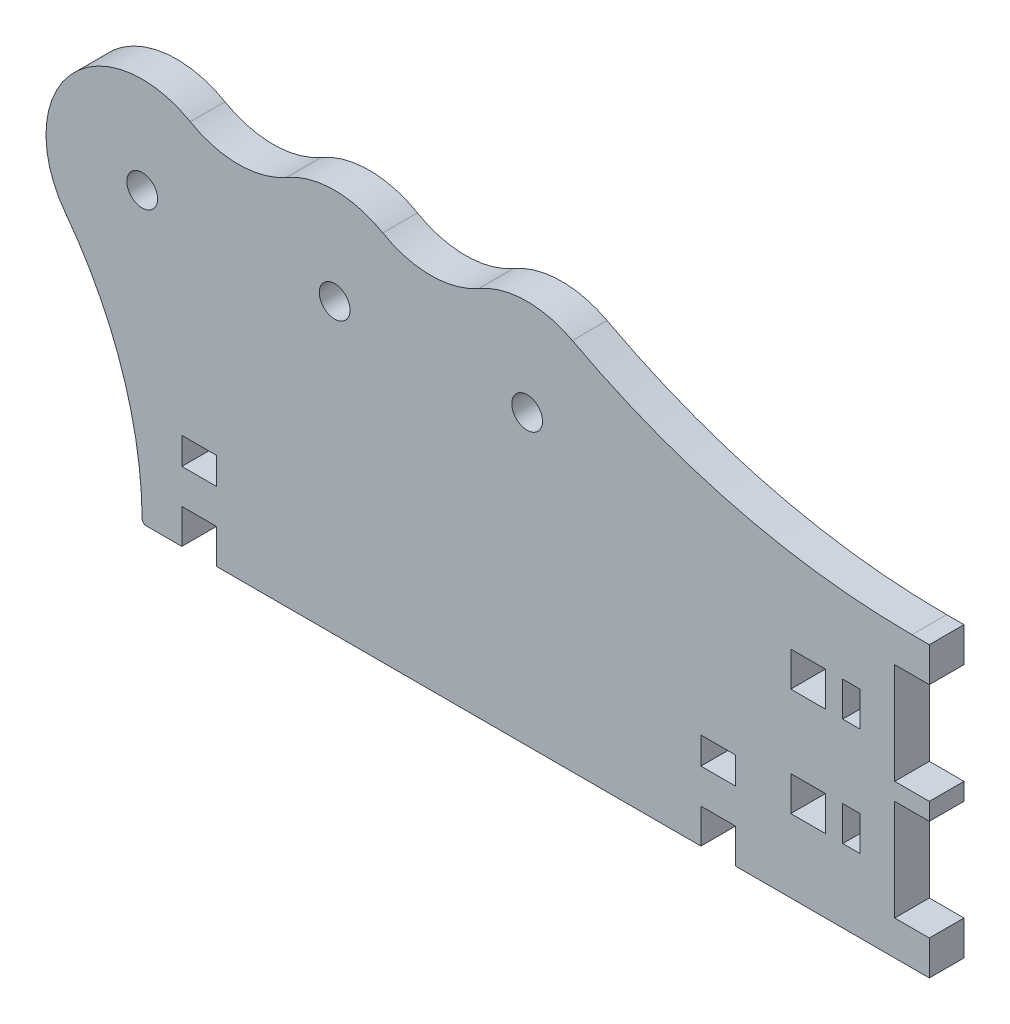
from build123d import *

# Parameters (mm, degrees)
SKETCH1_R                = 8
SKETCH1_R_2              = 4
BOSS_EXTRUDE1_DEPTH      = 9
BOSS_EXTRUDE1_2_DEPTH    = 9
SKETCH2_R                = 4
BOSS_EXTRUDE3_DEPTH      = 9
FILLET1_R                = 1
CUT_EXTRUDE1_DEPTH       = 214.789616212
SKETCH4_W                = 9
SKETCH4_H                = 27
BOSS_EXTRUDE4_DEPTH      = 75
BOSS_EXTRUDE5_START      = 9
SKETCH5_R                = 25
SKETCH5_R_2              = 4
BOSS_EXTRUDE5_DEPTH      = 9
BOSS_EXTRUDE6_DEPTH      = 4.5
BOSS_EXTRUDE6_DEPTH_BACK = 4.5
BOSS_EXTRUDE7_DEPTH      = 4.5
BOSS_EXTRUDE7_DEPTH_BACK = 4.5
BOSS_EXTRUDE7_START      = -25
SKETCH9_W                = 9
SKETCH9_H                = 7
SKETCH9_H_2              = 9
CUT_EXTRUDE2_DEPTH       = 217.612557346
CUT_EXTRUDE3_DEPTH       = 216.299790989
CUT_EXTRUDE3_DEPTH_BACK  = 216.299790989
CAVITY1_START            = -66
CAVITY1_OUTLINE_W        = 9
CAVITY1_OUTLINE_H        = 9
CAVITY1_DEPTH            = 26.25
CAVITY1_START_2          = -35.25
CAVITY1_2_OUTLINE_W      = 9
CAVITY1_2_OUTLINE_H      = 9
CAVITY1_2_DEPTH          = 26.25
CAVITY1_START_3          = -56
CAVITY1_3_OUTLINE_W      = 4.5
CAVITY1_3_OUTLINE_H      = 9
CAVITY1_3_OUTLINE_W_2    = 9
CAVITY1_3_DEPTH          = 9
CAVITY1_START_4          = -28
CAVITY1_4_OUTLINE_W      = 4.5
CAVITY1_4_OUTLINE_H      = 9
CAVITY1_4_OUTLINE_W_2    = 9
CAVITY1_4_DEPTH          = 9


# Read off the part's stored shape, not the designer's step: Cavity1
with BuildPart() as part:
    # Sketch1 → Boss-Extrude1 (new body)
    with BuildSketch(Plane.XY):
        with Locations((-125, 0)):
            Circle(SKETCH1_R)
        with Locations((-125, 0)):
            Circle(SKETCH1_R_2, mode=Mode.SUBTRACT)
    extrude(amount=BOSS_EXTRUDE1_DEPTH)



with BuildPart() as body_2:
    # Sketch1 → Boss-Extrude1 2 (new body)
    with BuildSketch(Plane.XY):
        with Locations((125, 0)):
            Circle(SKETCH1_R)
        with Locations((125, 0)):
            Circle(SKETCH1_R_2, mode=Mode.SUBTRACT)
    extrude(amount=BOSS_EXTRUDE1_2_DEPTH)


with BuildPart() as part_1:
    add(part.part)

    add(body_2.part)  # Boss-Extrude3 merges body 2
    # Sketch2 → Boss-Extrude3 (add)
    with BuildSketch(Plane.XY):
        with BuildLine():
            Line((-175, -75), (125, -75))
            ThreePointArc((125, -75), (130.131670325, -43.377223009), (145.000000492, -14.999999344))
            ThreePointArc((145.000000492, -14.999999344), (143.981414944, 16.269784471), (113.235294528, 22.058823748))
            ThreePointArc((113.235294528, 22.058823748), (25.000000075, 0), (-63.235294395, 22.058823677))
            ThreePointArc((-63.235294395, 22.058823677), (-75.420498385, 24.996463372), (-87.499999896, 21.650635154))
            ThreePointArc((-87.499999896, 21.650635154), (-99.999999954, 18.301270189), (-112.500000024, 21.650635108))
            ThreePointArc((-112.500000024, 21.650635108), (-124.99999995, 25), (-137.49999989, 21.650635158))
            ThreePointArc((-137.49999989, 21.650635158), (-149.999999954, 18.301270189), (-162.50000003, 21.650635112))
            ThreePointArc((-162.50000003, 21.650635112), (-193.705072901, 16.586749162), (-195.000000551, -14.999999265))
            ThreePointArc((-195.000000551, -14.999999265), (-180.13167034, -43.377222962), (-175, -75))
        make_face()
        with Locations((125, 0)):
            Circle(SKETCH2_R, mode=Mode.SUBTRACT)
        with Locations((-175, 0)):
            Circle(SKETCH2_R, mode=Mode.SUBTRACT)
        with Locations((-125, 0)):
            Circle(SKETCH2_R, mode=Mode.SUBTRACT)
        with Locations((-75, 0)):
            Circle(SKETCH2_R, mode=Mode.SUBTRACT)
    extrude(amount=BOSS_EXTRUDE3_DEPTH)

    # Fillet1
    fillet1_edges = [part_1.edges().sort_by_distance(p)[0] for p in [
        (-175, -75, 4.5),
        (125, -75, 4.5),
    ]]
    fillet(fillet1_edges, radius=FILLET1_R)

    # Sketch3 → Cut-Extrude1 (cut, through all)
    with BuildSketch(Plane.XY):
        Polygon((25, 0), (25, -75), (150, -75), (150, 25), (25, 25), align=None)
    extrude(amount=CUT_EXTRUDE1_DEPTH, mode=Mode.SUBTRACT)

    # Sketch4 → Boss-Extrude4 (add)
    with BuildSketch(Plane.XZ.offset(75)):
        with Locations((25, -4.5)):
            Rectangle(SKETCH4_W, SKETCH4_H)
    extrude(amount=-BOSS_EXTRUDE4_DEPTH)

    # Sketch5 → Boss-Extrude5 (add)
    # profile 1 of 4: a face of its own
    with BuildSketch(Plane(origin=(0, 0, -18), x_dir=(-1, 0, 0), z_dir=(0, 0, -1)).offset(BOSS_EXTRUDE5_START)):
        with BuildLine():
            ThreePointArc((-145.000000304, -14.999999594), (-130.131670275, -43.377223158), (-125, -75))
            Line((-125, -75), (-29.5, -75))
            Line((-29.5, -75), (-29.5, 0))
            Line((-29.5, 0), (-100, 0))
            ThreePointArc((-100, 0), (-117.09430609, -23.717082532), (-145.000000304, -14.999999594))
        make_face()
    # profile 2 of 4: a face of its own
    with BuildSketch(Plane(origin=(0, 0, -18), x_dir=(-1, 0, 0), z_dir=(0, 0, -1)).offset(BOSS_EXTRUDE5_START)):
        with Locations((-125, 0)):
            Circle(SKETCH5_R)
        with Locations((-125, 0)):
            Circle(SKETCH5_R_2, mode=Mode.SUBTRACT)
    # profile 3 of 4: a face of its own
    with BuildSketch(Plane(origin=(0, 0, -18), x_dir=(-1, 0, 0), z_dir=(0, 0, -1)).offset(BOSS_EXTRUDE5_START)):
        Polygon((-29.5, 0), (-29.5, -75), (-20.5, -75), (-20.5, 0), (-25, 0), align=None)
    # profile 4 of 4: a face of its own
    with BuildSketch(Plane(origin=(0, 0, -18), x_dir=(-1, 0, 0), z_dir=(0, 0, -1)).offset(BOSS_EXTRUDE5_START)):
        with BuildLine():
            Line((-100, 0), (-29.5, 0))
            Line((-29.5, 0), (-25, 0))
            ThreePointArc((-25, 0), (-70.475429529, 5.598281181), (-113.235293817, 22.058823369))
            ThreePointArc((-113.235293817, 22.058823369), (-103.56267677, 12.86239374), (-100, 0))
        make_face()
    extrude(amount=-BOSS_EXTRUDE5_DEPTH)

    # Sketch7 → Boss-Extrude6 (add, two sides: drawn at the far end of the back side and taken through both)
    with BuildSketch(Plane(origin=(0, -25, 0), x_dir=(1, 0, 0), z_dir=(0, 1, 0)).offset(-BOSS_EXTRUDE6_DEPTH_BACK)):
        with BuildLine():
            Line((56.5, 18), (29.5, 18))
            Line((29.5, 18), (29.5, -9))
            ThreePointArc((29.5, -9), (48.591883092, -1.091883092), (56.5, 18))
        make_face()
        with BuildLine():
            Line((-6.5, 0), (20.5, 0))
            Line((20.5, 0), (20.5, 27))
            ThreePointArc((20.5, 27), (1.408116908, 19.091883092), (-6.5, 0))
        make_face()
    extrude(amount=BOSS_EXTRUDE6_DEPTH + BOSS_EXTRUDE6_DEPTH_BACK)

    # Sketch7<3> → Boss-Extrude7 (add, two sides: drawn at the far end of the back side and taken through both)
    with BuildSketch(Plane(origin=(0, -25, 0), x_dir=(1, 0, 0), z_dir=(0, 1, 0)).offset(BOSS_EXTRUDE7_START - BOSS_EXTRUDE7_DEPTH_BACK)):
        with BuildLine():
            Line((56.5, 18), (29.5, 18))
            Line((29.5, 18), (29.5, -9))
            ThreePointArc((29.5, -9), (48.591883092, -1.091883092), (56.5, 18))
        make_face()
        with BuildLine():
            Line((-6.5, 0), (20.5, 0))
            Line((20.5, 0), (20.5, 27))
            ThreePointArc((20.5, 27), (1.408116908, 19.091883092), (-6.5, 0))
        make_face()
    extrude(amount=BOSS_EXTRUDE7_DEPTH + BOSS_EXTRUDE7_DEPTH_BACK)

    # Sketch9 → Cut-Extrude2 (cut, through all)
    with BuildSketch(Plane.XY.offset(9)):
        with Locations((-160.208548161, -53.5)):
            Rectangle(SKETCH9_W, SKETCH9_H)
        with Locations((-160.208548161, -70.5)):
            Rectangle(SKETCH9_W, SKETCH9_H_2)
        with Locations((-25.351798772, -53.5)):
            Rectangle(SKETCH9_W, SKETCH9_H)
        with Locations((-25.351798772, -70.5)):
            Rectangle(SKETCH9_W, SKETCH9_H_2)
        with Locations((109.504950616, -53.5)):
            Rectangle(SKETCH9_W, SKETCH9_H)
        with Locations((109.504950616, -70.5)):
            Rectangle(SKETCH9_W, SKETCH9_H_2)
    extrude(amount=-CUT_EXTRUDE2_DEPTH, mode=Mode.SUBTRACT)

    # Sketch10 → Cut-Extrude3 (cut, two sides: drawn at the far end of the back side and taken through both)
    with BuildSketch(Plane(origin=(0, 0, 0), x_dir=(1, 0, 0), z_dir=(0, 1, 0)).offset(-CUT_EXTRUDE3_DEPTH_BACK)):
        Polygon((-200, 27), (-200, 0), (29.5, 0), (29.5, -9), (150, -9), (150, 18), (20.5, 18), (20.5, 27), align=None)
    extrude(amount=CUT_EXTRUDE3_DEPTH + CUT_EXTRUDE3_DEPTH_BACK, mode=Mode.SUBTRACT)


with BuildPart() as cut_extrude3_kept_piece:
    # of the separate pieces the step leaves, the one the design keeps (cut_extrude3_pieces_kept)
    add(part_1.part.solids().sort_by_distance((-175.0049016, -74.00990099, 0))[0])

    # Cavity1 outline → Cavity1 (cut)
    with BuildSketch(Plane(origin=(0, 0, 0), x_dir=(1, 0, 0), z_dir=(0, 1, 0)).offset(CAVITY1_START)):
        with Locations((25, -4.5)):
            Rectangle(CAVITY1_OUTLINE_W, CAVITY1_OUTLINE_H)
    extrude(amount=CAVITY1_DEPTH, mode=Mode.SUBTRACT)

    # Cavity1 2 outline → Cavity1 2 (cut)
    with BuildSketch(Plane(origin=(0, 0, 0), x_dir=(1, 0, 0), z_dir=(0, 1, 0)).offset(CAVITY1_START_2)):
        with Locations((25, -4.5)):
            Rectangle(CAVITY1_2_OUTLINE_W, CAVITY1_2_OUTLINE_H)
    extrude(amount=CAVITY1_2_DEPTH, mode=Mode.SUBTRACT)

    # Cavity1 3 outline → Cavity1 3 (cut)
    with BuildSketch(Plane(origin=(0, 0, 0), x_dir=(1, 0, 0), z_dir=(0, 1, 0)).offset(CAVITY1_START_3)):
        with Locations((9.25, -4.5)):
            Rectangle(CAVITY1_3_OUTLINE_W, CAVITY1_3_OUTLINE_H)
        with Locations((-2, -4.5)):
            Rectangle(CAVITY1_3_OUTLINE_W_2, CAVITY1_3_OUTLINE_H)
    extrude(amount=CAVITY1_3_DEPTH, mode=Mode.SUBTRACT)

    # Cavity1 4 outline → Cavity1 4 (cut)
    with BuildSketch(Plane(origin=(0, 0, 0), x_dir=(1, 0, 0), z_dir=(0, 1, 0)).offset(CAVITY1_START_4)):
        with Locations((9.25, -4.5)):
            Rectangle(CAVITY1_4_OUTLINE_W, CAVITY1_4_OUTLINE_H)
        with Locations((-2, -4.5)):
            Rectangle(CAVITY1_4_OUTLINE_W_2, CAVITY1_4_OUTLINE_H)
    extrude(amount=CAVITY1_4_DEPTH, mode=Mode.SUBTRACT)


solid = cut_extrude3_kept_piece.part
